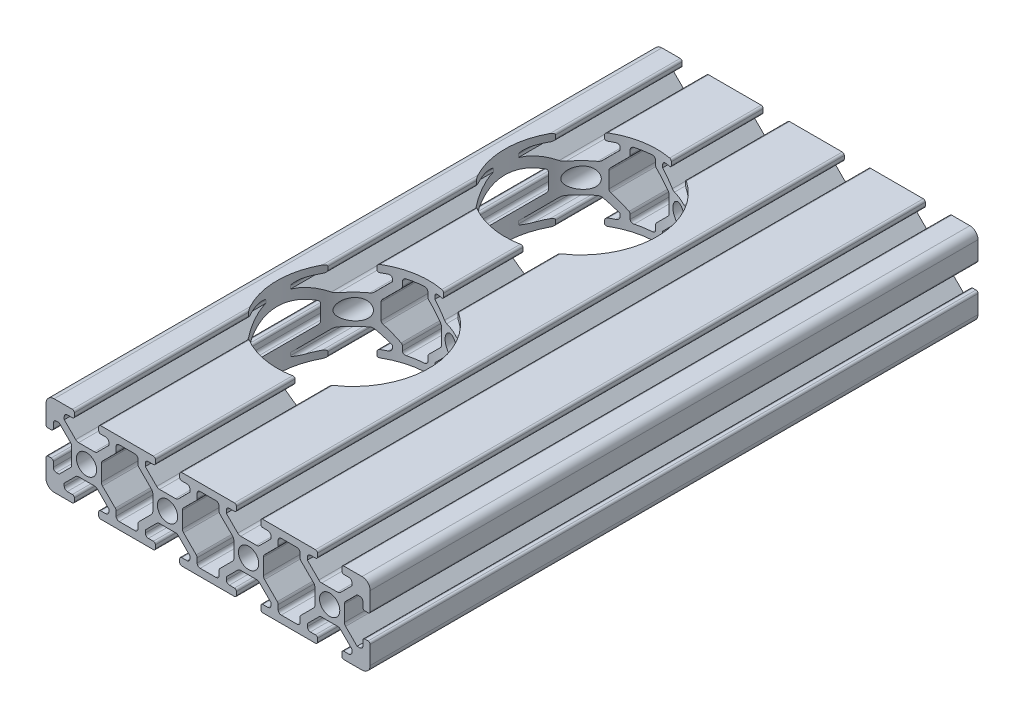
from build123d import *

# Parameters (mm, degrees)
SKETCH1_R           = 2.5
BOSS_EXTRUDE1_DEPTH = 150
SKETCH2_R           = 18.75
CUT_EXTRUDE1_DEPTH  = 158.576268486


with BuildPart() as part:
    # Sketch1 → Boss-Extrude1 (new body)
    with BuildSketch(Plane.XY):
        with BuildLine():
            Line((-41.934956355, 2.341454023), (-37.434956355, 2.341454023))
            ThreePointArc((-37.434956355, 2.341454023), (-37.081402965, 2.487900633), (-36.934956355, 2.841454023))
            Line((-36.934956355, 2.841454023), (-36.934956355, 3.641454023))
            ThreePointArc((-36.934956355, 3.641454023), (-37.081402965, 3.995007414), (-37.434956355, 4.141454023))
            Line((-37.434956355, 4.141454023), (-38.684956355, 4.141454023))
            ThreePointArc((-38.684956355, 4.141454023), (-39.215286441, 4.361123937), (-39.434956355, 4.891454023))
            Line((-39.434956355, 4.891454023), (-39.434956355, 5.568661817))
            Line((-39.434956355, 5.568661817), (-36.605057368, 8.398560804))
            ThreePointArc((-36.605057368, 8.398560804), (-36.280634019, 8.615333556), (-35.897950587, 8.691454023))
            Line((-35.897950587, 8.691454023), (-31.971962124, 8.691454023))
            ThreePointArc((-31.971962124, 8.691454023), (-31.589278691, 8.615333556), (-31.264855343, 8.398560804))
            Line((-31.264855343, 8.398560804), (-28.434956355, 5.568661817))
            Line((-28.434956355, 5.568661817), (-28.434956355, 4.891454023))
            ThreePointArc((-28.434956355, 4.891454023), (-28.654626269, 4.361123937), (-29.184956355, 4.141454023))
            Line((-29.184956355, 4.141454023), (-30.434956355, 4.141454023))
            ThreePointArc((-30.434956355, 4.141454023), (-30.788509746, 3.995007414), (-30.934956355, 3.641454023))
            Line((-30.934956355, 3.641454023), (-30.934956355, 2.841454023))
            ThreePointArc((-30.934956355, 2.841454023), (-30.788509746, 2.487900633), (-30.434956355, 2.341454023))
            Line((-30.434956355, 2.341454023), (-17.434956355, 2.341454023))
            ThreePointArc((-17.434956355, 2.341454023), (-17.081402965, 2.487900633), (-16.934956355, 2.841454023))
            Line((-16.934956355, 2.841454023), (-16.934956355, 3.641454023))
            ThreePointArc((-16.934956355, 3.641454023), (-17.081402965, 3.995007414), (-17.434956355, 4.141454023))
            Line((-17.434956355, 4.141454023), (-18.684956355, 4.141454023))
            ThreePointArc((-18.684956355, 4.141454023), (-19.215286441, 4.361123937), (-19.434956355, 4.891454023))
            Line((-19.434956355, 4.891454023), (-19.434956355, 5.568661817))
            Line((-19.434956355, 5.568661817), (-16.605057368, 8.398560804))
            ThreePointArc((-16.605057368, 8.398560804), (-16.280634019, 8.615333556), (-15.897950587, 8.691454023))
            Line((-15.897950587, 8.691454023), (-11.971962124, 8.691454023))
            ThreePointArc((-11.971962124, 8.691454023), (-11.589278691, 8.615333556), (-11.264855343, 8.398560804))
            Line((-11.264855343, 8.398560804), (-8.434956355, 5.568661817))
            Line((-8.434956355, 5.568661817), (-8.434956355, 4.891454023))
            ThreePointArc((-8.434956355, 4.891454023), (-8.654626269, 4.361123937), (-9.184956355, 4.141454023))
            Line((-9.184956355, 4.141454023), (-10.434956355, 4.141454023))
            ThreePointArc((-10.434956355, 4.141454023), (-10.788509746, 3.995007414), (-10.934956355, 3.641454023))
            Line((-10.934956355, 3.641454023), (-10.934956355, 2.841454023))
            ThreePointArc((-10.934956355, 2.841454023), (-10.788509746, 2.487900633), (-10.434956355, 2.341454023))
            Line((-10.434956355, 2.341454023), (2.565043645, 2.341454023))
            ThreePointArc((2.565043645, 2.341454023), (2.918597035, 2.487900633), (3.065043645, 2.841454023))
            Line((3.065043645, 2.841454023), (3.065043645, 3.641454023))
            ThreePointArc((3.065043645, 3.641454023), (2.918597035, 3.995007414), (2.565043645, 4.141454023))
            Line((2.565043645, 4.141454023), (1.315043645, 4.141454023))
            ThreePointArc((1.315043645, 4.141454023), (0.784713559, 4.361123937), (0.565043645, 4.891454023))
            Line((0.565043645, 4.891454023), (0.565043645, 5.568661817))
            Line((0.565043645, 5.568661817), (3.394942632, 8.398560804))
            ThreePointArc((3.394942632, 8.398560804), (3.719365981, 8.615333556), (4.102049413, 8.691454023))
            Line((4.102049413, 8.691454023), (8.028037876, 8.691454023))
            ThreePointArc((8.028037876, 8.691454023), (8.410721309, 8.615333556), (8.735144657, 8.398560804))
            Line((8.735144657, 8.398560804), (11.565043645, 5.568661817))
            Line((11.565043645, 5.568661817), (11.565043645, 4.891454023))
            ThreePointArc((11.565043645, 4.891454023), (11.345373731, 4.361123937), (10.815043645, 4.141454023))
            Line((10.815043645, 4.141454023), (9.565043645, 4.141454023))
            ThreePointArc((9.565043645, 4.141454023), (9.211490254, 3.995007414), (9.065043645, 3.641454023))
            Line((9.065043645, 3.641454023), (9.065043645, 2.841454023))
            ThreePointArc((9.065043645, 2.841454023), (9.211490254, 2.487900633), (9.565043645, 2.341454023))
            Line((9.565043645, 2.341454023), (22.565043645, 2.341454023))
            ThreePointArc((22.565043645, 2.341454023), (22.918597035, 2.487900633), (23.065043645, 2.841454023))
            Line((23.065043645, 2.841454023), (23.065043645, 3.641454023))
            ThreePointArc((23.065043645, 3.641454023), (22.918597035, 3.995007414), (22.565043645, 4.141454023))
            Line((22.565043645, 4.141454023), (21.315043645, 4.141454023))
            ThreePointArc((21.315043645, 4.141454023), (20.784713559, 4.361123937), (20.565043645, 4.891454023))
            Line((20.565043645, 4.891454023), (20.565043645, 5.568661817))
            Line((20.565043645, 5.568661817), (23.394942632, 8.398560804))
            ThreePointArc((23.394942632, 8.398560804), (23.719365981, 8.615333556), (24.102049413, 8.691454023))
            Line((24.102049413, 8.691454023), (28.028037876, 8.691454023))
            ThreePointArc((28.028037876, 8.691454023), (28.410721309, 8.615333556), (28.735144657, 8.398560804))
            Line((28.735144657, 8.398560804), (31.565043645, 5.568661817))
            Line((31.565043645, 5.568661817), (31.565043645, 4.891454023))
            ThreePointArc((31.565043645, 4.891454023), (31.345373731, 4.361123937), (30.815043645, 4.141454023))
            Line((30.815043645, 4.141454023), (29.565043645, 4.141454023))
            ThreePointArc((29.565043645, 4.141454023), (29.211490254, 3.995007414), (29.065043645, 3.641454023))
            Line((29.065043645, 3.641454023), (29.065043645, 2.841454023))
            ThreePointArc((29.065043645, 2.841454023), (29.211490254, 2.487900633), (29.565043645, 2.341454023))
            Line((29.565043645, 2.341454023), (34.065043645, 2.341454023))
            ThreePointArc((34.065043645, 2.341454023), (35.479257207, 2.927240461), (36.065043645, 4.341454023))
            Line((36.065043645, 4.341454023), (36.065043645, 8.841454023))
            ThreePointArc((36.065043645, 8.841454023), (35.918597035, 9.195007414), (35.565043645, 9.341454023))
            Line((35.565043645, 9.341454023), (34.765043645, 9.341454023))
            ThreePointArc((34.765043645, 9.341454023), (34.411490254, 9.195007414), (34.265043645, 8.841454023))
            Line((34.265043645, 8.841454023), (34.265043645, 7.591454023))
            ThreePointArc((34.265043645, 7.591454023), (34.045373731, 7.061123937), (33.515043645, 6.841454023))
            Line((33.515043645, 6.841454023), (32.837835851, 6.841454023))
            Line((32.837835851, 6.841454023), (30.007936864, 9.671353011))
            ThreePointArc((30.007936864, 9.671353011), (29.791164112, 9.995776359), (29.715043645, 10.378459792))
            Line((29.715043645, 10.378459792), (29.715043645, 14.304448255))
            ThreePointArc((29.715043645, 14.304448255), (29.791164112, 14.687131687), (30.007936864, 15.011555036))
            Line((30.007936864, 15.011555036), (32.837835851, 17.841454023))
            Line((32.837835851, 17.841454023), (33.515043645, 17.841454023))
            ThreePointArc((33.515043645, 17.841454023), (34.045373731, 17.621784109), (34.265043645, 17.091454023))
            Line((34.265043645, 17.091454023), (34.265043645, 15.841454023))
            ThreePointArc((34.265043645, 15.841454023), (34.411490254, 15.487900633), (34.765043645, 15.341454023))
            Line((34.765043645, 15.341454023), (35.565043645, 15.341454023))
            ThreePointArc((35.565043645, 15.341454023), (35.918597035, 15.487900633), (36.065043645, 15.841454023))
            Line((36.065043645, 15.841454023), (36.065043645, 20.341454023))
            ThreePointArc((36.065043645, 20.341454023), (35.479257207, 21.755667586), (34.065043645, 22.341454023))
            Line((34.065043645, 22.341454023), (29.565043645, 22.341454023))
            ThreePointArc((29.565043645, 22.341454023), (29.211490254, 22.195007414), (29.065043645, 21.841454023))
            Line((29.065043645, 21.841454023), (29.065043645, 21.041454023))
            ThreePointArc((29.065043645, 21.041454023), (29.211490254, 20.687900633), (29.565043645, 20.541454023))
            Line((29.565043645, 20.541454023), (30.815043645, 20.541454023))
            ThreePointArc((30.815043645, 20.541454023), (31.345373731, 20.321784109), (31.565043645, 19.791454023))
            Line((31.565043645, 19.791454023), (31.565043645, 19.114246229))
            Line((31.565043645, 19.114246229), (28.735144657, 16.284347242))
            ThreePointArc((28.735144657, 16.284347242), (28.410721309, 16.067574491), (28.028037876, 15.991454023))
            Line((28.028037876, 15.991454023), (24.102049413, 15.991454023))
            ThreePointArc((24.102049413, 15.991454023), (23.719365981, 16.067574491), (23.394942632, 16.284347242))
            Line((23.394942632, 16.284347242), (20.565043645, 19.114246229))
            Line((20.565043645, 19.114246229), (20.565043645, 19.791454023))
            ThreePointArc((20.565043645, 19.791454023), (20.784713559, 20.321784109), (21.315043645, 20.541454023))
            Line((21.315043645, 20.541454023), (22.565043645, 20.541454023))
            ThreePointArc((22.565043645, 20.541454023), (22.918597035, 20.687900633), (23.065043645, 21.041454023))
            Line((23.065043645, 21.041454023), (23.065043645, 21.841454023))
            ThreePointArc((23.065043645, 21.841454023), (22.918597035, 22.195007414), (22.565043645, 22.341454023))
            Line((22.565043645, 22.341454023), (9.565043645, 22.341454023))
            ThreePointArc((9.565043645, 22.341454023), (9.211490254, 22.195007414), (9.065043645, 21.841454023))
            Line((9.065043645, 21.841454023), (9.065043645, 21.041454023))
            ThreePointArc((9.065043645, 21.041454023), (9.211490254, 20.687900633), (9.565043645, 20.541454023))
            Line((9.565043645, 20.541454023), (10.815043645, 20.541454023))
            ThreePointArc((10.815043645, 20.541454023), (11.345373731, 20.321784109), (11.565043645, 19.791454023))
            Line((11.565043645, 19.791454023), (11.565043645, 19.114246229))
            Line((11.565043645, 19.114246229), (8.735144657, 16.284347242))
            ThreePointArc((8.735144657, 16.284347242), (8.410721309, 16.067574491), (8.028037876, 15.991454023))
            Line((8.028037876, 15.991454023), (4.102049413, 15.991454023))
            ThreePointArc((4.102049413, 15.991454023), (3.719365981, 16.067574491), (3.394942632, 16.284347242))
            Line((3.394942632, 16.284347242), (0.565043645, 19.114246229))
            Line((0.565043645, 19.114246229), (0.565043645, 19.791454023))
            ThreePointArc((0.565043645, 19.791454023), (0.784713559, 20.321784109), (1.315043645, 20.541454023))
            Line((1.315043645, 20.541454023), (2.565043645, 20.541454023))
            ThreePointArc((2.565043645, 20.541454023), (2.918597035, 20.687900633), (3.065043645, 21.041454023))
            Line((3.065043645, 21.041454023), (3.065043645, 21.841454023))
            ThreePointArc((3.065043645, 21.841454023), (2.918597035, 22.195007414), (2.565043645, 22.341454023))
            Line((2.565043645, 22.341454023), (-10.434956355, 22.341454023))
            ThreePointArc((-10.434956355, 22.341454023), (-10.788509746, 22.195007414), (-10.934956355, 21.841454023))
            Line((-10.934956355, 21.841454023), (-10.934956355, 21.041454023))
            ThreePointArc((-10.934956355, 21.041454023), (-10.788509746, 20.687900633), (-10.434956355, 20.541454023))
            Line((-10.434956355, 20.541454023), (-9.184956355, 20.541454023))
            ThreePointArc((-9.184956355, 20.541454023), (-8.654626269, 20.321784109), (-8.434956355, 19.791454023))
            Line((-8.434956355, 19.791454023), (-8.434956355, 19.114246229))
            Line((-8.434956355, 19.114246229), (-11.264855343, 16.284347242))
            ThreePointArc((-11.264855343, 16.284347242), (-11.589278691, 16.067574491), (-11.971962124, 15.991454023))
            Line((-11.971962124, 15.991454023), (-15.897950587, 15.991454023))
            ThreePointArc((-15.897950587, 15.991454023), (-16.280634019, 16.067574491), (-16.605057368, 16.284347242))
            Line((-16.605057368, 16.284347242), (-19.434956355, 19.114246229))
            Line((-19.434956355, 19.114246229), (-19.434956355, 19.791454023))
            ThreePointArc((-19.434956355, 19.791454023), (-19.215286441, 20.321784109), (-18.684956355, 20.541454023))
            Line((-18.684956355, 20.541454023), (-17.434956355, 20.541454023))
            ThreePointArc((-17.434956355, 20.541454023), (-17.081402965, 20.687900633), (-16.934956355, 21.041454023))
            Line((-16.934956355, 21.041454023), (-16.934956355, 21.841454023))
            ThreePointArc((-16.934956355, 21.841454023), (-17.081402965, 22.195007414), (-17.434956355, 22.341454023))
            Line((-17.434956355, 22.341454023), (-30.434956355, 22.341454023))
            ThreePointArc((-30.434956355, 22.341454023), (-30.788509746, 22.195007414), (-30.934956355, 21.841454023))
            Line((-30.934956355, 21.841454023), (-30.934956355, 21.041454023))
            ThreePointArc((-30.934956355, 21.041454023), (-30.788509746, 20.687900633), (-30.434956355, 20.541454023))
            Line((-30.434956355, 20.541454023), (-29.184956355, 20.541454023))
            ThreePointArc((-29.184956355, 20.541454023), (-28.654626269, 20.321784109), (-28.434956355, 19.791454023))
            Line((-28.434956355, 19.791454023), (-28.434956355, 19.114246229))
            Line((-28.434956355, 19.114246229), (-31.264855343, 16.284347242))
            ThreePointArc((-31.264855343, 16.284347242), (-31.589278691, 16.067574491), (-31.971962124, 15.991454023))
            Line((-31.971962124, 15.991454023), (-35.897950587, 15.991454023))
            ThreePointArc((-35.897950587, 15.991454023), (-36.280634019, 16.067574491), (-36.605057368, 16.284347242))
            Line((-36.605057368, 16.284347242), (-39.434956355, 19.114246229))
            Line((-39.434956355, 19.114246229), (-39.434956355, 19.791454023))
            ThreePointArc((-39.434956355, 19.791454023), (-39.215286441, 20.321784109), (-38.684956355, 20.541454023))
            Line((-38.684956355, 20.541454023), (-37.434956355, 20.541454023))
            ThreePointArc((-37.434956355, 20.541454023), (-37.081402965, 20.687900633), (-36.934956355, 21.041454023))
            Line((-36.934956355, 21.041454023), (-36.934956355, 21.841454023))
            ThreePointArc((-36.934956355, 21.841454023), (-37.081402965, 22.195007414), (-37.434956355, 22.341454023))
            Line((-37.434956355, 22.341454023), (-41.934956355, 22.341454023))
            ThreePointArc((-41.934956355, 22.341454023), (-43.349169918, 21.755667586), (-43.934956355, 20.341454023))
            Line((-43.934956355, 20.341454023), (-43.934956355, 15.841454023))
            ThreePointArc((-43.934956355, 15.841454023), (-43.788509746, 15.487900633), (-43.434956355, 15.341454023))
            Line((-43.434956355, 15.341454023), (-42.634956355, 15.341454023))
            ThreePointArc((-42.634956355, 15.341454023), (-42.281402965, 15.487900633), (-42.134956355, 15.841454023))
            Line((-42.134956355, 15.841454023), (-42.134956355, 17.091454023))
            ThreePointArc((-42.134956355, 17.091454023), (-41.915286441, 17.621784109), (-41.384956355, 17.841454023))
            Line((-41.384956355, 17.841454023), (-40.707748561, 17.841454023))
            Line((-40.707748561, 17.841454023), (-37.877849574, 15.011555036))
            ThreePointArc((-37.877849574, 15.011555036), (-37.661076823, 14.687131687), (-37.584956355, 14.304448255))
            Line((-37.584956355, 14.304448255), (-37.584956355, 10.378459792))
            ThreePointArc((-37.584956355, 10.378459792), (-37.661076823, 9.995776359), (-37.877849574, 9.671353011))
            Line((-37.877849574, 9.671353011), (-40.707748561, 6.841454023))
            Line((-40.707748561, 6.841454023), (-41.384956355, 6.841454023))
            ThreePointArc((-41.384956355, 6.841454023), (-41.915286441, 7.061123937), (-42.134956355, 7.591454023))
            Line((-42.134956355, 7.591454023), (-42.134956355, 8.841454023))
            ThreePointArc((-42.134956355, 8.841454023), (-42.281402965, 9.195007414), (-42.634956355, 9.341454023))
            Line((-42.634956355, 9.341454023), (-43.434956355, 9.341454023))
            ThreePointArc((-43.434956355, 9.341454023), (-43.788509746, 9.195007414), (-43.934956355, 8.841454023))
            Line((-43.934956355, 8.841454023), (-43.934956355, 4.341454023))
            ThreePointArc((-43.934956355, 4.341454023), (-43.349169918, 2.927240461), (-41.934956355, 2.341454023))
        make_face()
        with Locations((-33.934956355, 12.341454023)):
            Circle(SKETCH1_R, mode=Mode.SUBTRACT)
        with Locations((-13.934956355, 12.341454023)):
            Circle(SKETCH1_R, mode=Mode.SUBTRACT)
        with Locations((6.065043645, 12.341454023)):
            Circle(SKETCH1_R, mode=Mode.SUBTRACT)
        with Locations((26.065043645, 12.341454023)):
            Circle(SKETCH1_R, mode=Mode.SUBTRACT)
        with BuildLine():
            Line((-9.992063136, 15.011555036), (-6.854626269, 18.148991903))
            ThreePointArc((-6.854626269, 18.148991903), (-6.692046706, 18.392309415), (-6.634956355, 18.679321989))
            Line((-6.634956355, 18.679321989), (-6.634956355, 19.791454023))
            ThreePointArc((-6.634956355, 19.791454023), (-6.415286441, 20.321784109), (-5.884956355, 20.541454023))
            Line((-5.884956355, 20.541454023), (-1.984956355, 20.541454023))
            ThreePointArc((-1.984956355, 20.541454023), (-1.454626269, 20.321784109), (-1.234956355, 19.791454023))
            Line((-1.234956355, 19.791454023), (-1.234956355, 18.679321989))
            ThreePointArc((-1.234956355, 18.679321989), (-1.177866005, 18.392309415), (-1.015286441, 18.148991903))
            Line((-1.015286441, 18.148991903), (2.122150426, 15.011555036))
            ThreePointArc((2.122150426, 15.011555036), (2.338923177, 14.687131687), (2.415043645, 14.304448255))
            Line((2.415043645, 14.304448255), (2.415043645, 10.378459792))
            ThreePointArc((2.415043645, 10.378459792), (2.338923177, 9.995776359), (2.122150426, 9.671353011))
            Line((2.122150426, 9.671353011), (-1.015286441, 6.533916144))
            ThreePointArc((-1.015286441, 6.533916144), (-1.177866005, 6.290598632), (-1.234956355, 6.003586058))
            Line((-1.234956355, 6.003586058), (-1.234956355, 4.891454023))
            ThreePointArc((-1.234956355, 4.891454023), (-1.454626269, 4.361123937), (-1.984956355, 4.141454023))
            Line((-1.984956355, 4.141454023), (-5.884956355, 4.141454023))
            ThreePointArc((-5.884956355, 4.141454023), (-6.415286441, 4.361123937), (-6.634956355, 4.891454023))
            Line((-6.634956355, 4.891454023), (-6.634956355, 6.003586058))
            ThreePointArc((-6.634956355, 6.003586058), (-6.692046706, 6.290598632), (-6.854626269, 6.533916144))
            Line((-6.854626269, 6.533916144), (-9.992063136, 9.671353011))
            ThreePointArc((-9.992063136, 9.671353011), (-10.208835888, 9.995776359), (-10.284956355, 10.378459792))
            Line((-10.284956355, 10.378459792), (-10.284956355, 14.304448255))
            ThreePointArc((-10.284956355, 14.304448255), (-10.208835888, 14.687131687), (-9.992063136, 15.011555036))
        make_face(mode=Mode.SUBTRACT)
        with BuildLine():
            Line((-21.015286441, 18.148991903), (-17.877849574, 15.011555036))
            ThreePointArc((-17.877849574, 15.011555036), (-17.661076823, 14.687131687), (-17.584956355, 14.304448255))
            Line((-17.584956355, 14.304448255), (-17.584956355, 10.378459792))
            ThreePointArc((-17.584956355, 10.378459792), (-17.661076823, 9.995776359), (-17.877849574, 9.671353011))
            Line((-17.877849574, 9.671353011), (-21.015286441, 6.533916144))
            ThreePointArc((-21.015286441, 6.533916144), (-21.177866005, 6.290598632), (-21.234956355, 6.003586058))
            Line((-21.234956355, 6.003586058), (-21.234956355, 4.891454023))
            ThreePointArc((-21.234956355, 4.891454023), (-21.454626269, 4.361123937), (-21.984956355, 4.141454023))
            Line((-21.984956355, 4.141454023), (-25.884956355, 4.141454023))
            ThreePointArc((-25.884956355, 4.141454023), (-26.415286441, 4.361123937), (-26.634956355, 4.891454023))
            Line((-26.634956355, 4.891454023), (-26.634956355, 6.003586058))
            ThreePointArc((-26.634956355, 6.003586058), (-26.692046706, 6.290598632), (-26.854626269, 6.533916144))
            Line((-26.854626269, 6.533916144), (-29.992063136, 9.671353011))
            ThreePointArc((-29.992063136, 9.671353011), (-30.208835888, 9.995776359), (-30.284956355, 10.378459792))
            Line((-30.284956355, 10.378459792), (-30.284956355, 14.304448255))
            ThreePointArc((-30.284956355, 14.304448255), (-30.208835888, 14.687131687), (-29.992063136, 15.011555036))
            Line((-29.992063136, 15.011555036), (-26.854626269, 18.148991903))
            ThreePointArc((-26.854626269, 18.148991903), (-26.692046706, 18.392309415), (-26.634956355, 18.679321989))
            Line((-26.634956355, 18.679321989), (-26.634956355, 19.791454023))
            ThreePointArc((-26.634956355, 19.791454023), (-26.415286441, 20.321784109), (-25.884956355, 20.541454023))
            Line((-25.884956355, 20.541454023), (-21.984956355, 20.541454023))
            ThreePointArc((-21.984956355, 20.541454023), (-21.454626269, 20.321784109), (-21.234956355, 19.791454023))
            Line((-21.234956355, 19.791454023), (-21.234956355, 18.679321989))
            ThreePointArc((-21.234956355, 18.679321989), (-21.177866005, 18.392309415), (-21.015286441, 18.148991903))
        make_face(mode=Mode.SUBTRACT)
        with BuildLine():
            Line((18.984713559, 18.148991903), (22.122150426, 15.011555036))
            ThreePointArc((22.122150426, 15.011555036), (22.338923177, 14.687131687), (22.415043645, 14.304448255))
            Line((22.415043645, 14.304448255), (22.415043645, 10.378459792))
            ThreePointArc((22.415043645, 10.378459792), (22.338923177, 9.995776359), (22.122150426, 9.671353011))
            Line((22.122150426, 9.671353011), (18.984713559, 6.533916144))
            ThreePointArc((18.984713559, 6.533916144), (18.822133995, 6.290598632), (18.765043645, 6.003586058))
            Line((18.765043645, 6.003586058), (18.765043645, 4.891454023))
            ThreePointArc((18.765043645, 4.891454023), (18.545373731, 4.361123937), (18.015043645, 4.141454023))
            Line((18.015043645, 4.141454023), (14.115043645, 4.141454023))
            ThreePointArc((14.115043645, 4.141454023), (13.584713559, 4.361123937), (13.365043645, 4.891454023))
            Line((13.365043645, 4.891454023), (13.365043645, 6.003586058))
            ThreePointArc((13.365043645, 6.003586058), (13.307953294, 6.290598632), (13.145373731, 6.533916144))
            Line((13.145373731, 6.533916144), (10.007936864, 9.671353011))
            ThreePointArc((10.007936864, 9.671353011), (9.791164112, 9.995776359), (9.715043645, 10.378459792))
            Line((9.715043645, 10.378459792), (9.715043645, 14.304448255))
            ThreePointArc((9.715043645, 14.304448255), (9.791164112, 14.687131687), (10.007936864, 15.011555036))
            Line((10.007936864, 15.011555036), (13.145373731, 18.148991903))
            ThreePointArc((13.145373731, 18.148991903), (13.307953294, 18.392309415), (13.365043645, 18.679321989))
            Line((13.365043645, 18.679321989), (13.365043645, 19.791454023))
            ThreePointArc((13.365043645, 19.791454023), (13.584713559, 20.321784109), (14.115043645, 20.541454023))
            Line((14.115043645, 20.541454023), (18.015043645, 20.541454023))
            ThreePointArc((18.015043645, 20.541454023), (18.545373731, 20.321784109), (18.765043645, 19.791454023))
            Line((18.765043645, 19.791454023), (18.765043645, 18.679321989))
            ThreePointArc((18.765043645, 18.679321989), (18.822133995, 18.392309415), (18.984713559, 18.148991903))
        make_face(mode=Mode.SUBTRACT)
    extrude(amount=BOSS_EXTRUDE1_DEPTH)

    # Sketch2 → Cut-Extrude1 (cut, through all)
    with BuildSketch(Plane(origin=(0, 22.341454023, 0), x_dir=(1, 0, 0), z_dir=(0, 1, 0))):
        with Locations((-20.934956355, -41)):
            Circle(SKETCH2_R)
        with Locations((-20.934956355, -97.216)):
            Circle(SKETCH2_R)
    extrude(amount=-CUT_EXTRUDE1_DEPTH, mode=Mode.SUBTRACT)


solid = part.part
